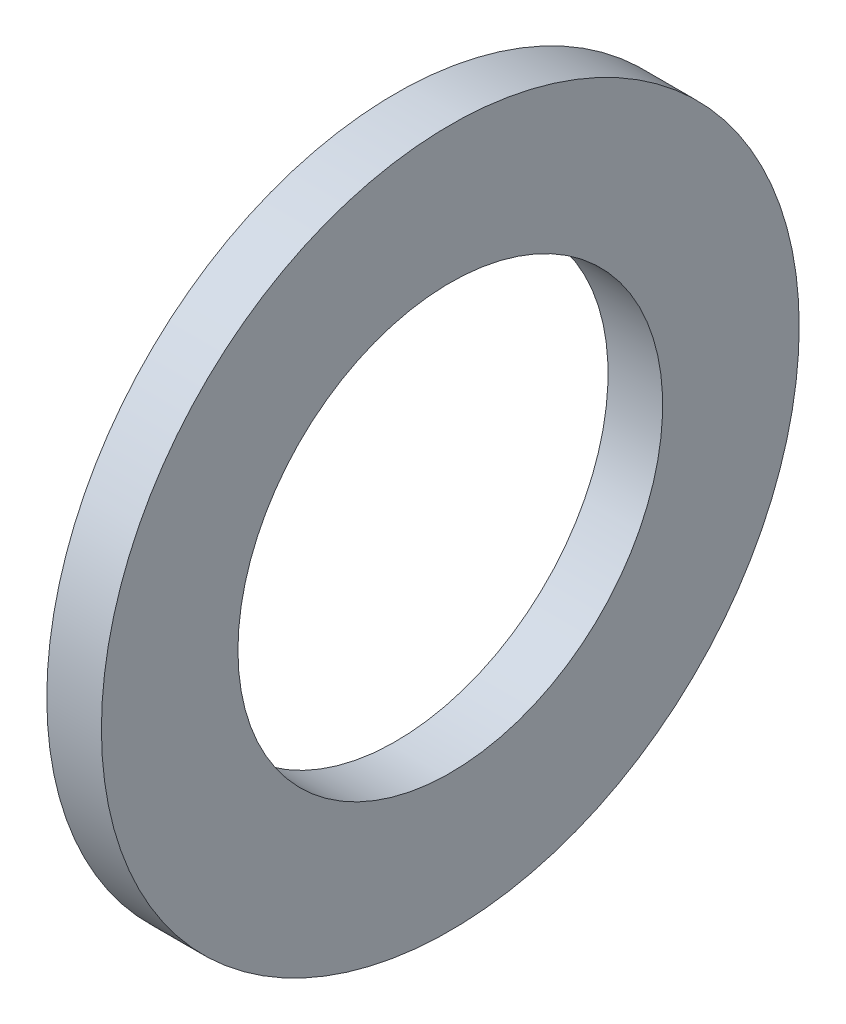
from build123d import *

# Parameters (mm, degrees)
SKETCH1_W = 9
SKETCH1_H = 22.5


with BuildPart() as part:
    # Sketch1 → Base-Revolve (revolve)
    with BuildSketch(Plane.XY):
        with Locations((-4.5, 46.25)):
            Rectangle(SKETCH1_W, SKETCH1_H)
    revolve(axis=Axis((-34.925, 0, 0), (1, 0, 0)))


solid = part.part
